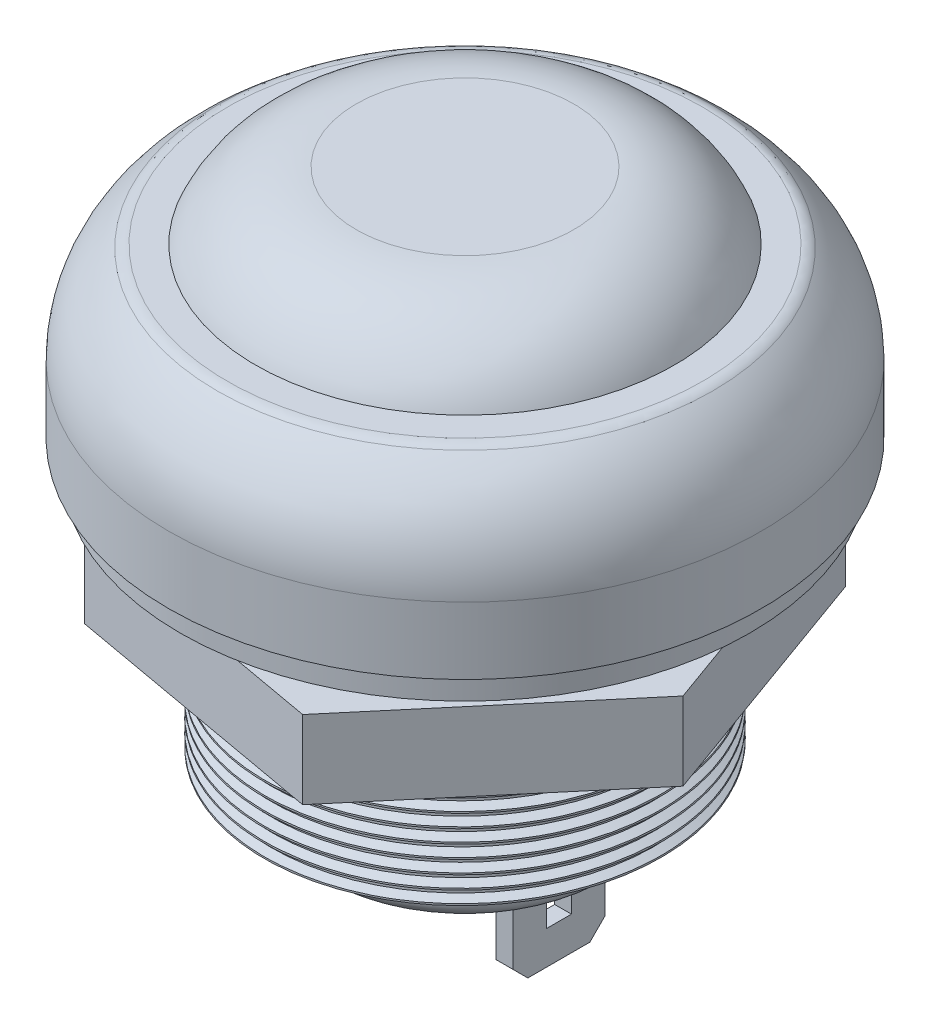
from build123d import *

# Parameters (mm, degrees)
SKETCH2_R              = 4.295
BOSS_EXTRUDE1_DEPTH    = 1.5
SKETCH3_W              = 0.5
SKETCH3_H              = 2.75
BOSS_EXTRUDE2_DEPTH    = 2.6
BOSS_EXTRUDE2_2_DEPTH  = 2.6
SKETCH5_R              = 6.25
BOSS_EXTRUDE3_DEPTH    = 2
THREAD1_PITCH          = 0.396875
CUT_EXTRUDE1_START     = -5.6
CUT_EXTRUDE1_OUTLINE_W = 0.75
CUT_EXTRUDE1_OUTLINE_H = 1.6
CUT_EXTRUDE1_DEPTH     = 5.6
CHAMFER1_SIZE          = 0.45
CHAMFER2_SIZE          = 0.45
FILLET1_R              = 0.5
FILLET2_R              = 0.5
SKETCH15_R             = 8.5
SKETCH15_R_2           = 6.8
BOSS_EXTRUDE4_DEPTH    = 0.8
SKETCH16_R             = 5.5
BOSS_EXTRUDE5_DEPTH    = 2.33


# Read off the part's stored shape, not the designer's step: Cut-Extrude1
with BuildPart() as part:
    # Sketch1 → Revolve1 (revolve)
    with BuildSketch(Plane.XY, mode=Mode.PRIVATE) as revolve1_sk:
        Polygon((0, 6.5), (0, -6.5), (5.915, -6.5), (5.915, -0.3), (6.74, -0.3), (6.74, 1.5), (8.84, 1.5), (8.84, 6.5), align=None)
    revolve(revolve1_sk.sketch.rotate(Axis((0, 6.5, 0), (0, -1, 0)), 90), axis=Axis((0, 6.5, 0), (0, -1, 0)))

    # Sketch9 → Cut-Revolve2 (revolve, cut)
    with BuildSketch(Plane.XY, mode=Mode.PRIVATE) as cut_revolve2_sk:
        with BuildLine():
            Line((8.84, 3.5), (9.598817433, 3.5))
            Line((9.598817433, 3.5), (9.598817433, 6.865118826))
            Line((9.598817433, 6.865118826), (7.25, 6.865118826))
            Line((7.25, 6.865118826), (7.25, 6.5))
            ThreePointArc((7.25, 6.5), (8.417929795, 5.197652791), (8.84, 3.5))
        make_face()
    revolve(cut_revolve2_sk.sketch.rotate(Axis((0, 8.5, 0), (0, -1, 0)), 90), axis=Axis((0, 8.5, 0), (0, -1, 0)), mode=Mode.SUBTRACT)

    # Thread1: the profile of Thread Profile1 profile screwed along a right-hand helix of 17.5 turns, 6 arcs to a turn; built about Z, then put on its axis
    thread1_z = Axis((0, 0, 0), (0, 0, 1))
    thread1_corners = [(5.9153, 0, -0.000173205), (5.9153, 0, 0.347438829), (5.700185106, 0, 0.223242187), (5.700185106, 0, 0.124023437)]
    with BuildLine(mode=Mode.PRIVATE) as thread1_profile:
        Line(thread1_corners[0], thread1_corners[1])
        Line(thread1_corners[1], thread1_corners[2])
        Line(thread1_corners[2], thread1_corners[3])
        Line(thread1_corners[3], thread1_corners[0])
    thread1_cap = Face(thread1_profile.wire())
    thread1_turn_angles = [0, 30, 60, 90, 120, 150, 180, 210, 240, 270, 300, 330, 360]
    thread1_turn_weights = [1, 0.8660254037844387, 1, 0.8660254037844387, 1, 0.8660254037844387, 1, 0.8660254037844387, 1, 0.8660254037844387, 1, 0.8660254037844387, 1]
    thread1_turn_rails = [Edge.make_bspline([Vector(p[0], p[1], 0).rotate(thread1_z, thread1_turn_angles[k]) / thread1_turn_weights[k] + Vector(0, 0, p[2] + THREAD1_PITCH * thread1_turn_angles[k] / 360) for k in range(13)], [0, 0, 0, 1, 1, 2, 2, 3, 3, 4, 4, 5, 5, 6, 6, 6], 2, thread1_turn_weights) for p in thread1_corners]
    thread1_turn_sides = [Face.make_surface_from_curves(thread1_turn_rails[p[0]], thread1_turn_rails[p[1]]) for p in [(0, 1), (1, 2), (2, 3), (3, 0)]]
    thread1_last_angles = [6120, 6150, 6180, 6210, 6240, 6270, 6300]
    thread1_last_weights = [1, 0.8660254037844387, 1, 0.8660254037844387, 1, 0.8660254037844387, 1]
    thread1_last_rails = [Edge.make_bspline([Vector(p[0], p[1], 0).rotate(thread1_z, thread1_last_angles[k]) / thread1_last_weights[k] + Vector(0, 0, p[2] + THREAD1_PITCH * thread1_last_angles[k] / 360) for k in range(7)], [0, 0, 0, 1, 1, 2, 2, 3, 3, 3], 2, thread1_last_weights) for p in thread1_corners]
    thread1_last_sides = [Face.make_surface_from_curves(thread1_last_rails[p[0]], thread1_last_rails[p[1]]) for p in [(0, 1), (1, 2), (2, 3), (3, 0)]]
    thread1 = Plane(origin=(0, -7.5, 0), x_dir=(1, 0, 0), z_dir=(0, 1, 0)) * Solid(Shell([*[p.moved(Location((0, 0, THREAD1_PITCH * i))) for i in range(17) for p in thread1_turn_sides], *thread1_last_sides, thread1_cap, thread1_cap.rotate(thread1_z, 6300).moved(Location((0, 0, THREAD1_PITCH * 6300 / 360)))]))
    add(thread1, mode=Mode.SUBTRACT)

    # Fillet1
    fillet1_edges = [part.edges().sort_by_distance(p)[0] for p in [
        (0, 6.5, -7.25),
    ]]
    fillet(fillet1_edges, radius=FILLET1_R)


with BuildPart() as body_2:
    # Sketch2 → Boss-Extrude1 (new body)
    with BuildSketch(Plane.XZ.offset(6.5)):
        with Locations(Location((0, 0, 0), (0, 0, 270))):
            Circle(SKETCH2_R)
    extrude(amount=BOSS_EXTRUDE1_DEPTH)

    # Fillet2
    fillet2_edges = [body_2.edges().sort_by_distance(p)[0] for p in [
        (0, -8, 4.295),
    ]]
    fillet(fillet2_edges, radius=FILLET2_R)


with BuildPart() as body_3:
    # Sketch3 → Boss-Extrude2 (new body)
    with BuildSketch(Plane.XZ.offset(8)):
        with Locations((2.55, 0)):
            Rectangle(SKETCH3_W, SKETCH3_H)
    extrude(amount=BOSS_EXTRUDE2_DEPTH)


with BuildPart() as body_4:
    # Sketch3 → Boss-Extrude2 2 (new body)
    with BuildSketch(Plane.XZ.offset(8)):
        with Locations((-2.55, 0)):
            Rectangle(SKETCH3_W, SKETCH3_H)
    extrude(amount=BOSS_EXTRUDE2_2_DEPTH)


with BuildPart() as body_5:
    # Sketch5 → Boss-Extrude3 (new body)
    with BuildSketch(Plane(origin=(0, 6.5, 0), x_dir=(1, 0, 0), z_dir=(0, 1, 0))):
        with Locations(Location((0, 0, 0), (0, 0, 270))):
            Circle(SKETCH5_R)
    extrude(amount=BOSS_EXTRUDE3_DEPTH)

    # Sketch8 → Cut-Revolve1 (revolve, cut)
    with BuildSketch(Plane.XY, mode=Mode.PRIVATE) as cut_revolve1_sk:
        with BuildLine():
            Line((3.25, 8.5), (3.25, 9.819478645))
            Line((3.25, 9.819478645), (7.095108276, 9.819478645))
            Line((7.095108276, 9.819478645), (7.095108276, 6.5))
            Line((7.095108276, 6.5), (6.25, 6.5))
            ThreePointArc((6.25, 6.5), (5.052775638, 7.954163457), (3.25, 8.5))
        make_face()
    revolve(cut_revolve1_sk.sketch.rotate(Axis((0, 8.5, 0), (0, -1, 0)), 180), axis=Axis((0, 8.5, 0), (0, -1, 0)), mode=Mode.SUBTRACT)


with BuildPart() as cut_extrude1_tool:
    # Cut-Extrude1 outline → Cut-Extrude1 (new body)
    with BuildSketch(Plane.ZY.offset(2.8).offset(CUT_EXTRUDE1_START)):
        with Locations((0, -8.8)):
            Rectangle(CUT_EXTRUDE1_OUTLINE_W, CUT_EXTRUDE1_OUTLINE_H)
    extrude(amount=CUT_EXTRUDE1_DEPTH)


with BuildPart() as body_3_1:
    add(body_3.part)

    # Cut-Extrude1: cut by cut_extrude1_tool
    add(cut_extrude1_tool.part, mode=Mode.SUBTRACT)

    # Chamfer2
    chamfer2_edges = [body_3_1.edges().sort_by_distance(p)[0] for p in [
        (2.55, -10.6, -1.375),
        (2.55, -10.6, 1.375),
    ]]
    chamfer(chamfer2_edges, length=CHAMFER2_SIZE)


with BuildPart() as body_4_1:
    add(body_4.part)

    # Cut-Extrude1: cut by cut_extrude1_tool
    add(cut_extrude1_tool.part, mode=Mode.SUBTRACT)

    # Chamfer1
    chamfer1_edges = [body_4_1.edges().sort_by_distance(p)[0] for p in [
        (-2.55, -10.6, -1.375),
        (-2.55, -10.6, 1.375),
    ]]
    chamfer(chamfer1_edges, length=CHAMFER1_SIZE)


with BuildPart() as body_6:
    # Sketch15 → Boss-Extrude4 (new body)
    with BuildSketch(Plane.XZ.offset(-1.5)):
        with Locations(Location((0, 0, 0), (0, 0, 270))):
            Circle(SKETCH15_R)
        with Locations(Location((0, 0, 0), (0, 0, 270))):
            Circle(SKETCH15_R_2, mode=Mode.SUBTRACT)
    extrude(amount=BOSS_EXTRUDE4_DEPTH)


with BuildPart() as body_7:
    # Sketch16 → Boss-Extrude5 (new body)
    with BuildSketch(Plane.XZ.offset(0.5)):
        Polygon((5.195655548, -6.154076976), (7.927414772, 1.422531206), (2.731759224, 7.576608182), (-5.195655548, 6.154076976), (-7.927414772, -1.422531206), (-2.731759224, -7.576608182), align=None)
        with Locations(Location((0, 0, 0), (0, 0, 270))):
            Circle(SKETCH16_R, mode=Mode.SUBTRACT)
    extrude(amount=BOSS_EXTRUDE5_DEPTH)


solid = Compound([part.part, body_2.part, body_5.part, body_3_1.part, body_4_1.part, body_6.part, body_7.part])
